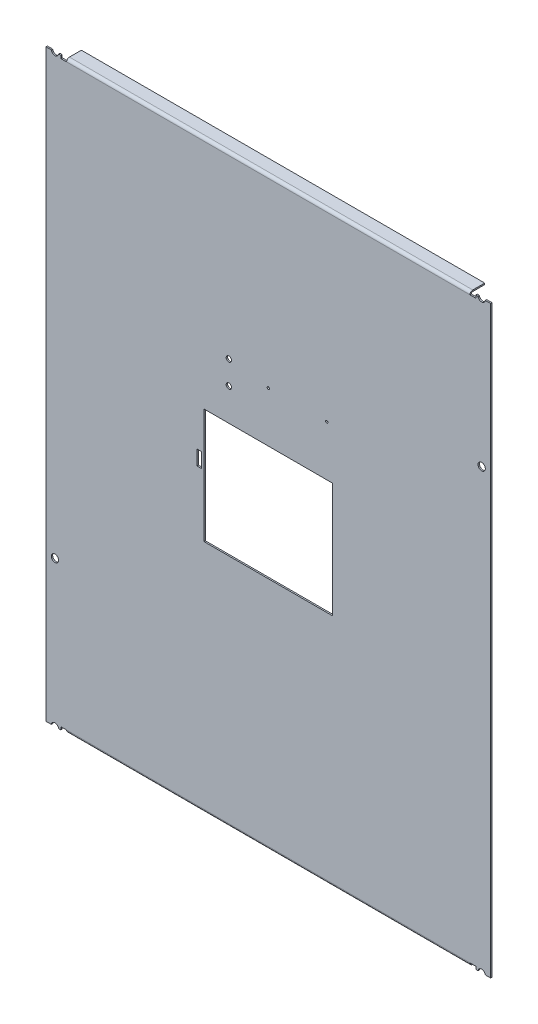
from build123d import *

# Parameters (mm, degrees)
CROQUIS1_W                   = 482.6
CROQUIS1_H                   = 634.238
BRIDA_BASE1_DEPTH            = 1.524
CROQUIS6_R                   = 3.9624
CROQUIS6_W                   = 6.35
CROQUIS6_H                   = 3.048
CORTAR_EXTRUIR1_DEPTH        = 399.487732229
BRIDA_START                  = -218.948
BRIDA_DE_ARISTA1_DEPTH       = 437.896
BRIDA_START_2                = -219.1004
BRIDA_DE_ARISTA1_2_OUTLINE_W = 0.1524
BRIDA_DE_ARISTA1_2_OUTLINE_H = 1.524
BRIDA_DE_ARISTA1_2_DEPTH     = 0.1524
BRIDA_START_3                = 218.948
BRIDA_DE_ARISTA1_3_OUTLINE_W = 0.1524
BRIDA_DE_ARISTA1_3_OUTLINE_H = 1.524
BRIDA_DE_ARISTA1_3_DEPTH     = 0.1524
BRIDA_DE_ARISTA1_4_DEPTH     = 437.896
CORTAR_EXTRUIR2_REACH        = 400.806
CROQUIS13_R                  = 3.9624
CROQUIS13_R_2                = 2.8956
CROQUIS13_R_3                = 1.27
CROQUIS13_W                  = 139.7
CROQUIS13_H                  = 124.714
CROQUIS13_W_2                = 4.826
CROQUIS13_H_2                = 16.002


# Read off the part's stored shape, not the designer's step: Brida de arista1
# Sheet-metal steps are written as plain solids
with BuildPart() as part:
    # Croquis1 → Brida base1 (new body)
    with BuildSketch(Plane.XY):
        Rectangle(CROQUIS1_W, CROQUIS1_H)
    extrude(amount=-BRIDA_BASE1_DEPTH)

    # Croquis6 → Cortar-Extruir1 (cut, through all)
    with BuildSketch(Plane.XY):
        with Locations((231.648, 317.627)):
            Circle(CROQUIS6_R)
        with Locations((-231.648, 317.627)):
            Circle(CROQUIS6_R)
        with Locations((-231.648, -317.627)):
            Circle(CROQUIS6_R)
        with Locations((231.648, -317.627)):
            Circle(CROQUIS6_R)
        with Locations((-222.123, 315.595)):
            Rectangle(CROQUIS6_W, CROQUIS6_H)
        with Locations((222.123, 315.595)):
            Rectangle(CROQUIS6_W, CROQUIS6_H)
        with Locations((-222.123, -315.595)):
            Rectangle(CROQUIS6_W, CROQUIS6_H)
        with Locations((222.123, -315.595)):
            Rectangle(CROQUIS6_W, CROQUIS6_H)
    extrude(amount=-CORTAR_EXTRUIR1_DEPTH, mode=Mode.SUBTRACT)

    # Brida de arista1 outline → Brida de arista1 (cut)
    with BuildSketch(Plane.YZ.offset(BRIDA_START)):
        with BuildLine():
            ThreePointArc((-316.710645431, -1.524), (-315.595, -0.408354569), (-314.071, 0))
            Line((-314.071, 0), (-317.119, 0))
            Line((-317.119, 0), (-317.119, -1.524))
            Line((-317.119, -1.524), (-316.710645431, -1.524))
        make_face()
        with BuildLine():
            Line((317.119, 0), (314.071, 0))
            ThreePointArc((314.071, 0), (315.595, -0.408354569), (316.710645431, -1.524))
            Line((316.710645431, -1.524), (317.119, -1.524))
            Line((317.119, -1.524), (317.119, 0))
        make_face()
    extrude(amount=BRIDA_DE_ARISTA1_DEPTH, mode=Mode.SUBTRACT)

    # Brida de arista1 2 outline → Brida de arista1 2 (cut)
    with BuildSketch(Plane.YZ.offset(BRIDA_START_2)):
        with Locations((-313.9948, -0.762)):
            Rectangle(BRIDA_DE_ARISTA1_2_OUTLINE_W, BRIDA_DE_ARISTA1_2_OUTLINE_H)
        with Locations((313.9948, -0.762)):
            Rectangle(BRIDA_DE_ARISTA1_2_OUTLINE_W, BRIDA_DE_ARISTA1_2_OUTLINE_H)
    extrude(amount=BRIDA_DE_ARISTA1_2_DEPTH, mode=Mode.SUBTRACT)

    # Brida de arista1 3 outline → Brida de arista1 3 (cut)
    with BuildSketch(Plane.YZ.offset(BRIDA_START_3)):
        with Locations((-313.9948, -0.762)):
            Rectangle(BRIDA_DE_ARISTA1_3_OUTLINE_W, BRIDA_DE_ARISTA1_3_OUTLINE_H)
        with Locations((313.9948, -0.762)):
            Rectangle(BRIDA_DE_ARISTA1_3_OUTLINE_W, BRIDA_DE_ARISTA1_3_OUTLINE_H)
    extrude(amount=BRIDA_DE_ARISTA1_3_DEPTH, mode=Mode.SUBTRACT)

    # Brida de arista1 4 outline → Brida de arista1 4 (add)
    with BuildSketch(Plane.YZ.offset(BRIDA_START)):
        with BuildLine():
            ThreePointArc((-315.595, -3.048), (-315.148630735, -1.970369265), (-314.071, -1.524))
            Line((-314.071, -1.524), (-316.710645431, -1.524))
            ThreePointArc((-316.710645431, -1.524), (-317.015141918, -2.259119551), (-317.119, -3.048))
            Line((-317.119, -3.048), (-317.119, -16.002))
            Line((-317.119, -16.002), (-315.595, -16.002))
            Line((-315.595, -16.002), (-315.595, -3.048))
        make_face()
        with BuildLine():
            Line((316.710645431, -1.524), (314.071, -1.524))
            ThreePointArc((314.071, -1.524), (315.148630735, -1.970369265), (315.595, -3.048))
            Line((315.595, -3.048), (315.595, -16.002))
            Line((315.595, -16.002), (317.119, -16.002))
            Line((317.119, -16.002), (317.119, -3.048))
            ThreePointArc((317.119, -3.048), (317.015141918, -2.259119551), (316.710645431, -1.524))
        make_face()
    extrude(amount=BRIDA_DE_ARISTA1_4_DEPTH)

    # Croquis13 → Cortar-Extruir2 (cut, up to next)
    with BuildSketch(Plane.XY, mode=Mode.PRIVATE) as cortar_extruir2_sk1:
        with Locations((-231.648, -158.877)):
            Circle(CROQUIS13_R)
    cortar_extruir2_tool1 = extrude(cortar_extruir2_sk1.sketch, amount=-CORTAR_EXTRUIR2_REACH, mode=Mode.PRIVATE) & part.part
    # Croquis13 → Cortar-Extruir2 (cut, up to next)
    with BuildSketch(Plane.XY, mode=Mode.PRIVATE) as cortar_extruir2_sk2:
        with Locations((231.648, 158.877)):
            Circle(CROQUIS13_R)
    cortar_extruir2_tool2 = extrude(cortar_extruir2_sk2.sketch, amount=-CORTAR_EXTRUIR2_REACH, mode=Mode.PRIVATE) & part.part
    # Croquis13 → Cortar-Extruir2 (cut, up to next)
    with BuildSketch(Plane.XY, mode=Mode.PRIVATE) as cortar_extruir2_sk3:
        with Locations((-42.8498, 97.409)):
            Circle(CROQUIS13_R_2)
    cortar_extruir2_tool3 = extrude(cortar_extruir2_sk3.sketch, amount=-CORTAR_EXTRUIR2_REACH, mode=Mode.PRIVATE) & part.part
    # Croquis13 → Cortar-Extruir2 (cut, up to next)
    with BuildSketch(Plane.XY, mode=Mode.PRIVATE) as cortar_extruir2_sk4:
        with Locations((-42.8498, 122.809)):
            Circle(CROQUIS13_R_2)
    cortar_extruir2_tool4 = extrude(cortar_extruir2_sk4.sketch, amount=-CORTAR_EXTRUIR2_REACH, mode=Mode.PRIVATE) & part.part
    # Croquis13 → Cortar-Extruir2 (cut, up to next)
    with BuildSketch(Plane.XY, mode=Mode.PRIVATE) as cortar_extruir2_sk5:
        with Locations((0, 116.967)):
            Circle(CROQUIS13_R_3)
    cortar_extruir2_tool5 = extrude(cortar_extruir2_sk5.sketch, amount=-CORTAR_EXTRUIR2_REACH, mode=Mode.PRIVATE) & part.part
    # Croquis13 → Cortar-Extruir2 (cut, up to next)
    with BuildSketch(Plane.XY, mode=Mode.PRIVATE) as cortar_extruir2_sk6:
        with Locations((63.5, 116.967)):
            Circle(CROQUIS13_R_3)
    cortar_extruir2_tool6 = extrude(cortar_extruir2_sk6.sketch, amount=-CORTAR_EXTRUIR2_REACH, mode=Mode.PRIVATE) & part.part
    # Croquis13 → Cortar-Extruir2 (cut, up to next)
    with BuildSketch(Plane.XY, mode=Mode.PRIVATE) as cortar_extruir2_sk7:
        Rectangle(CROQUIS13_W, CROQUIS13_H)
    cortar_extruir2_tool7 = extrude(cortar_extruir2_sk7.sketch, amount=-CORTAR_EXTRUIR2_REACH, mode=Mode.PRIVATE) & part.part
    # Croquis13 → Cortar-Extruir2 (cut, up to next)
    with BuildSketch(Plane.XY, mode=Mode.PRIVATE) as cortar_extruir2_sk8:
        with Locations((-75.057, 12.954)):
            Rectangle(CROQUIS13_W_2, CROQUIS13_H_2)
    cortar_extruir2_tool8 = extrude(cortar_extruir2_sk8.sketch, amount=-CORTAR_EXTRUIR2_REACH, mode=Mode.PRIVATE) & part.part
    add(cortar_extruir2_tool1.solids().sort_by_distance((-231.648, -158.877, 0))[0], mode=Mode.SUBTRACT)
    add(cortar_extruir2_tool2.solids().sort_by_distance((231.648, 158.877, 0))[0], mode=Mode.SUBTRACT)
    add(cortar_extruir2_tool3.solids().sort_by_distance((-42.8498, 97.409, 0))[0], mode=Mode.SUBTRACT)
    add(cortar_extruir2_tool4.solids().sort_by_distance((-42.8498, 122.809, 0))[0], mode=Mode.SUBTRACT)
    add(cortar_extruir2_tool5.solids().sort_by_distance((0, 116.967, 0))[0], mode=Mode.SUBTRACT)
    add(cortar_extruir2_tool6.solids().sort_by_distance((63.5, 116.967, 0))[0], mode=Mode.SUBTRACT)
    add(cortar_extruir2_tool7.solids().sort_by_distance((0, 0, 0))[0], mode=Mode.SUBTRACT)
    add(cortar_extruir2_tool8.solids().sort_by_distance((-75.057, 12.954, 0))[0], mode=Mode.SUBTRACT)


solid = part.part
